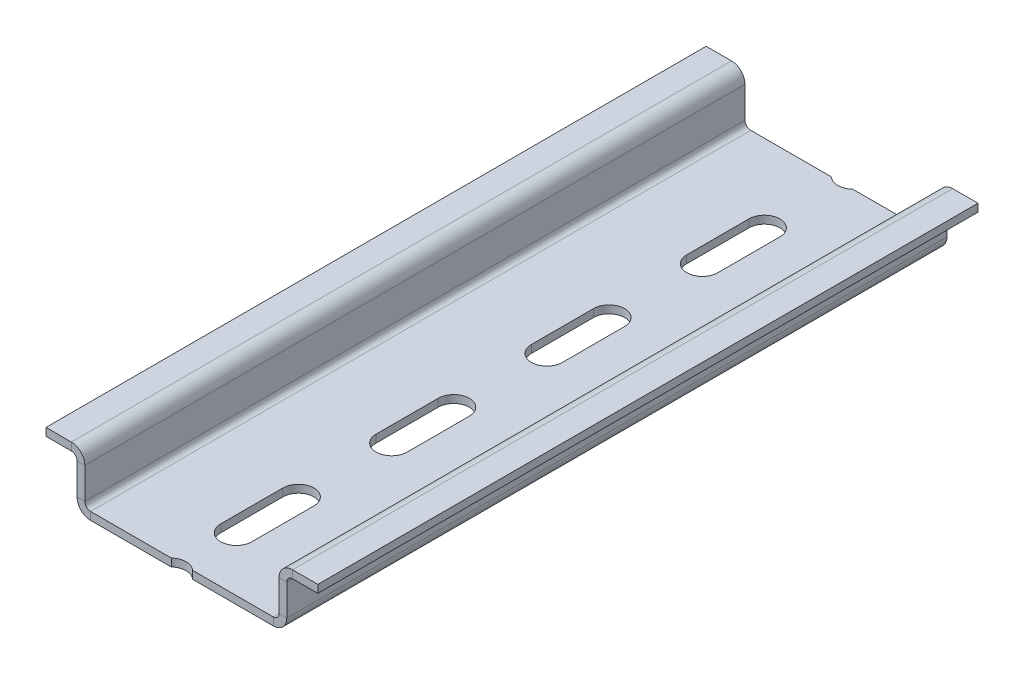
from build123d import *

# Parameters (mm, degrees)
SKETCH_1_W                         = 27
SKETCH_1_H                         = 1
SM_BASE_FLANGE_1_DEPTH             = 85
SM_EDGE_FLANGE_1_STRIP_W           = 5.4732
SM_EDGE_FLANGE_1_STRIP_H           = 1
SM_EDGE_FLANGE_1_STRIP_CUT_DEPTH   = 85
SM_EDGE_FLANGE_1_STRIP_2_W         = 5.4732
SM_EDGE_FLANGE_1_STRIP_2_H         = 1
SM_EDGE_FLANGE_1_STRIP_CUT_2_DEPTH = 85
SM_EDGE_FLANGE_1_DEPTH             = 85
SM_EDGE_FLANGE_1_BEND_DEPTH        = 85
SM_EDGE_FLANGE_2_STRIP_W           = 5.4732
SM_EDGE_FLANGE_2_STRIP_H           = 1
SM_EDGE_FLANGE_2_STRIP_CUT_DEPTH   = 85
SM_EDGE_FLANGE_2_STRIP_2_W         = 5.4732
SM_EDGE_FLANGE_2_STRIP_2_H         = 1
SM_EDGE_FLANGE_2_STRIP_CUT_2_DEPTH = 85
SM_EDGE_FLANGE_2_DEPTH             = 85
SM_EDGE_FLANGE_2_BEND_DEPTH        = 85
CUT_EXTRUDE_2_DEPTH                = 88.025858226
CUT_EXTRUDE_1_REACH                = 89.026
OTHER_3_DEPTH                      = 1


# Read off the part's stored shape, not the designer's step: Образец заполнения3
# Sheet-metal steps are written as plain solids
with BuildPart() as part:
    # Sketch 1 → Базовая кромка1 (new body)
    with BuildSketch(Plane.XY):
        with Locations((0, 0.5)):
            Rectangle(SKETCH_1_W, SKETCH_1_H)
    extrude(amount=SM_BASE_FLANGE_1_DEPTH)

    # Ребро-кромка1 strip (across the edge) → Ребро-кромка1 strip cut (cut)
    with BuildSketch(Plane(origin=(-13.5, 1, 0), x_dir=(1, 0, 0), z_dir=(0, 0, 1))):
        with Locations((-1, -0.5)):
            Rectangle(SM_EDGE_FLANGE_1_STRIP_W, SM_EDGE_FLANGE_1_STRIP_H)
    extrude(amount=SM_EDGE_FLANGE_1_STRIP_CUT_DEPTH, mode=Mode.SUBTRACT)

    # Ребро-кромка1 strip 2 (across the edge) → Ребро-кромка1 strip cut 2 (cut)
    with BuildSketch(Plane(origin=(13.5, 1, 85), x_dir=(-1, 0, 0), z_dir=(0, 0, -1))):
        with Locations((-1, -0.5)):
            Rectangle(SM_EDGE_FLANGE_1_STRIP_2_W, SM_EDGE_FLANGE_1_STRIP_2_H)
    extrude(amount=SM_EDGE_FLANGE_1_STRIP_CUT_2_DEPTH, mode=Mode.SUBTRACT)

    # Ребро-кромка1 section (across the edge) → Ребро-кромка1 (add)
    with BuildSketch(Plane(origin=(-13.5, 1, 0), x_dir=(1, 0, 0), z_dir=(0, 0, 1))):
        with BuildLine():
            Line((0, 0.7366), (0, 6.5))
            Line((0, 6.5), (1, 6.5))
            Line((1, 6.5), (1, 0.7366))
            ThreePointArc((1, 0.7366), (1.215745145, 0.215745145), (1.7366, 0))
            Line((1.7366, 0), (1.7366, -1))
            ThreePointArc((1.7366, -1), (0.508638364, -0.491361636), (0, 0.7366))
        make_face()
    extrude(amount=SM_EDGE_FLANGE_1_DEPTH)

    # Ребро-кромка1 section 2 (across the edge) → Ребро-кромка1 bend (add)
    with BuildSketch(Plane(origin=(13.5, 1, 85), x_dir=(-1, 0, 0), z_dir=(0, 0, -1))):
        with BuildLine():
            Line((0, 0.7366), (0, 6.5))
            Line((0, 6.5), (1, 6.5))
            Line((1, 6.5), (1, 0.7366))
            ThreePointArc((1, 0.7366), (1.215745145, 0.215745145), (1.7366, 0))
            Line((1.7366, 0), (1.7366, -1))
            ThreePointArc((1.7366, -1), (0.508638364, -0.491361636), (0, 0.7366))
        make_face()
    extrude(amount=SM_EDGE_FLANGE_1_BEND_DEPTH)

    # Ребро-кромка2 strip (across the edge) → Ребро-кромка2 strip cut (cut)
    with BuildSketch(Plane(origin=(-13.5, 7.5, 85), x_dir=(0, -1, 0), z_dir=(0, 0, -1))):
        with Locations((-1, -0.5)):
            Rectangle(SM_EDGE_FLANGE_2_STRIP_W, SM_EDGE_FLANGE_2_STRIP_H)
    extrude(amount=SM_EDGE_FLANGE_2_STRIP_CUT_DEPTH, mode=Mode.SUBTRACT)

    # Ребро-кромка2 strip 2 (across the edge) → Ребро-кромка2 strip cut 2 (cut)
    with BuildSketch(Plane(origin=(13.5, 7.5, 0), x_dir=(0, -1, 0), z_dir=(0, 0, 1))):
        with Locations((-1, -0.5)):
            Rectangle(SM_EDGE_FLANGE_2_STRIP_2_W, SM_EDGE_FLANGE_2_STRIP_2_H)
    extrude(amount=SM_EDGE_FLANGE_2_STRIP_CUT_2_DEPTH, mode=Mode.SUBTRACT)

    # Ребро-кромка2 section (across the edge) → Ребро-кромка2 (add)
    with BuildSketch(Plane(origin=(-13.5, 7.5, 85), x_dir=(0, -1, 0), z_dir=(0, 0, -1))):
        with BuildLine():
            Line((0, 0.7366), (0, 4))
            Line((0, 4), (1, 4))
            Line((1, 4), (1, 0.7366))
            ThreePointArc((1, 0.7366), (1.215745145, 0.215745145), (1.7366, 0))
            Line((1.7366, 0), (1.7366, -1))
            ThreePointArc((1.7366, -1), (0.508638364, -0.491361636), (0, 0.7366))
        make_face()
    extrude(amount=SM_EDGE_FLANGE_2_DEPTH)

    # Ребро-кромка2 section 2 (across the edge) → Ребро-кромка2 bend (add)
    with BuildSketch(Plane(origin=(13.5, 7.5, 0), x_dir=(0, -1, 0), z_dir=(0, 0, 1))):
        with BuildLine():
            Line((0, 0.7366), (0, 4))
            Line((0, 4), (1, 4))
            Line((1, 4), (1, 0.7366))
            ThreePointArc((1, 0.7366), (1.215745145, 0.215745145), (1.7366, 0))
            Line((1.7366, 0), (1.7366, -1))
            ThreePointArc((1.7366, -1), (0.508638364, -0.491361636), (0, 0.7366))
        make_face()
    extrude(amount=SM_EDGE_FLANGE_2_BEND_DEPTH)

    # Эскиз19 → Вырез-Вытянуть2 (cut, through all)
    with BuildSketch(Plane(origin=(0, 1, 0), x_dir=(1, 0, 0), z_dir=(0, 1, 0))):
        with BuildLine():
            Line((-1.370314889, 0), (1.370314889, 0))
            ThreePointArc((1.370314889, 0), (0, -0.54321), (-1.370314889, 0))
        make_face()
        with BuildLine():
            Line((-1.370314889, -85), (1.370314889, -85))
            ThreePointArc((1.370314889, -85), (0, -84.45679), (-1.370314889, -85))
        make_face()
    extrude(amount=-CUT_EXTRUDE_2_DEPTH, mode=Mode.SUBTRACT)

    # Эскиз18 → Вырез-Вытянуть1 (cut, up to next)
    with BuildSketch(Plane(origin=(0, 1, 0), x_dir=(1, 0, 0), z_dir=(0, 1, 0)), mode=Mode.PRIVATE) as cut_extrude_1_sk1:
        with BuildLine():
            Line((-2, -18), (-2, -10))
            ThreePointArc((-2, -10), (0, -8), (2, -10))
            Line((2, -10), (2, -18))
            ThreePointArc((2, -18), (0, -20), (-2, -18))
        make_face()
    cut_extrude_1_tool1 = extrude(cut_extrude_1_sk1.sketch, amount=-CUT_EXTRUDE_1_REACH, mode=Mode.PRIVATE) & part.part
    add(cut_extrude_1_tool1.solids().sort_by_distance((0, 1, 14))[0], mode=Mode.SUBTRACT)

    # Образец заполнения3 outline → Образец заполнения3 (cut)
    with BuildSketch(Plane(origin=(0, 0, 0), x_dir=(1, 0, 0), z_dir=(0, 1, 0))):
        with BuildLine():
            ThreePointArc((2, -30), (0, -28), (-2, -30))
            Line((-2, -30), (-2, -38))
            ThreePointArc((-2, -38), (0, -40), (2, -38))
            Line((2, -38), (2, -30))
        make_face()
        with BuildLine():
            ThreePointArc((2, -70), (0, -68), (-2, -70))
            Line((-2, -70), (-2, -78))
            ThreePointArc((-2, -78), (0, -80), (2, -78))
            Line((2, -78), (2, -70))
        make_face()
        with BuildLine():
            ThreePointArc((2, -50), (0, -48), (-2, -50))
            Line((-2, -50), (-2, -58))
            ThreePointArc((-2, -58), (0, -60), (2, -58))
            Line((2, -58), (2, -50))
        make_face()
    extrude(amount=OTHER_3_DEPTH, mode=Mode.SUBTRACT)


solid = part.part
